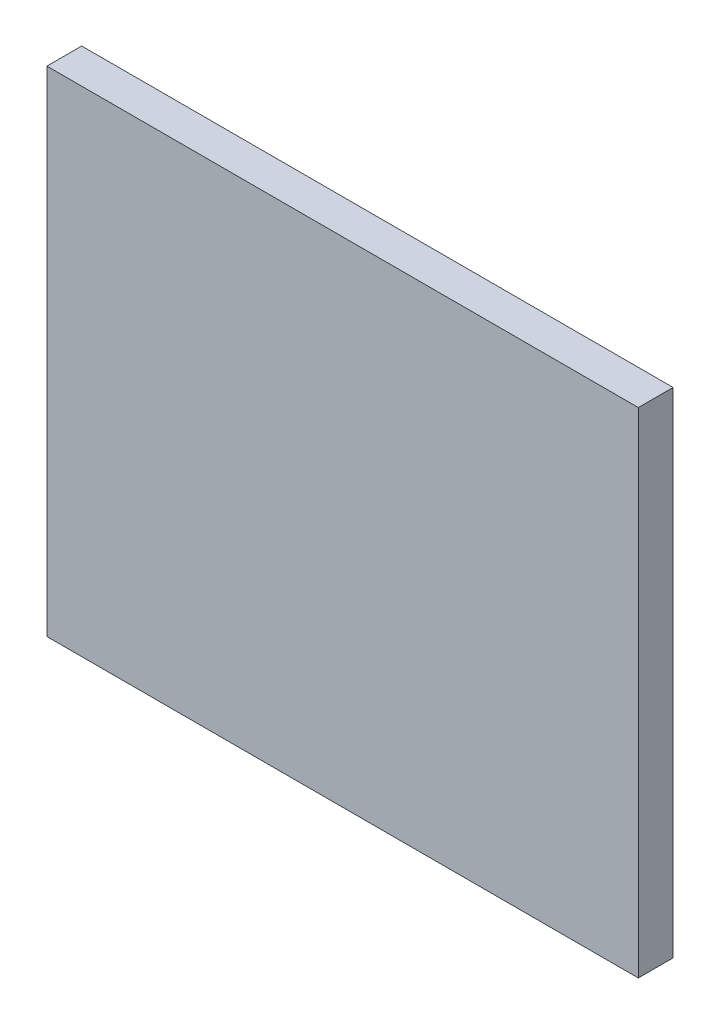
from build123d import *

# Parameters (mm, degrees)
SKETCH1_W           = 170
SKETCH1_H           = 142
BOSS_EXTRUDE1_DEPTH = 5


with BuildPart() as part:
    # Sketch1 → Boss-Extrude1 (new, symmetric)
    with BuildSketch(Plane.XY):
        Rectangle(SKETCH1_W, SKETCH1_H)
    extrude(amount=BOSS_EXTRUDE1_DEPTH, both=True)


solid = part.part
